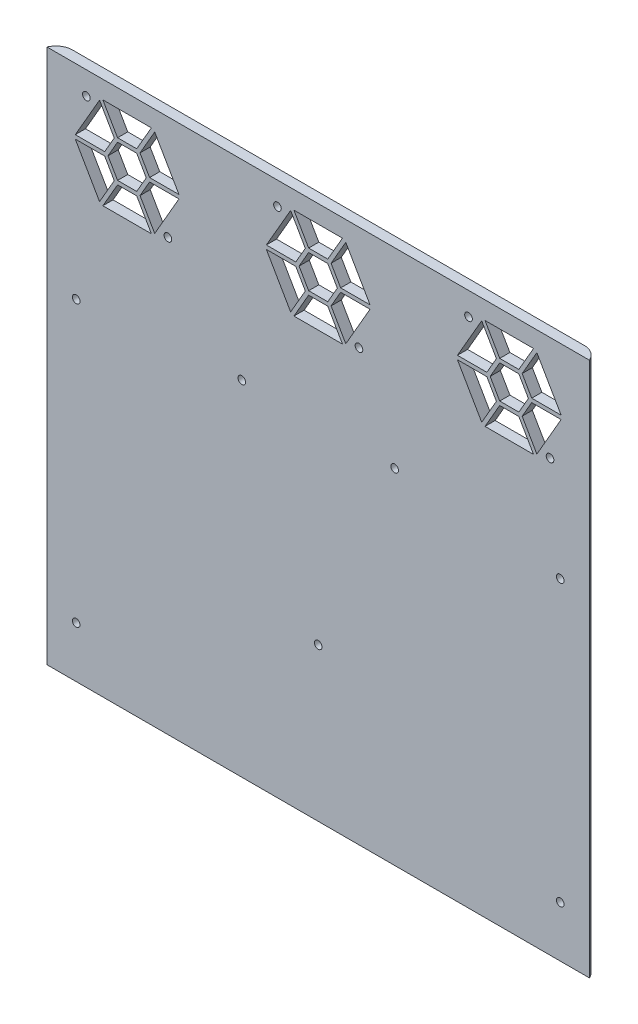
from build123d import *
from OCP.BRepFilletAPI import BRepFilletAPI_MakeChamfer

# Parameters (mm, degrees)
ESQUISSE1_W                = 213
ESQUISSE1_H                = 210
BOSS_EXTRU_1_DEPTH         = 4
CHANFREIN1_SIZE            = 4
CHANFREIN1_SIZE_2          = 2.309401077
CONG_1_R                   = 6.5
ESQUISSE2_R                = 1.5
ENL_V_MAT_EXTRU_1_DEPTH    = 236.495753677
ESQUISSE3_R                = 1.5
ENL_V_MAT_EXTRU_2_DEPTH    = 236.495753677
R_P_TITION_LIN_AIRE1_COUNT = 3
R_P_TITION_LIN_AIRE1_PITCH = 75
CHANFREIN2_SIZE            = 1.5


with BuildPart() as part:
    # Esquisse1 → Boss.-Extru.1 (new body)
    with BuildSketch(Plane.XY):
        with Locations((0, -105)):
            Rectangle(ESQUISSE1_W, ESQUISSE1_H)
    extrude(amount=BOSS_EXTRU_1_DEPTH)

    # Chanfrein1
    chanfrein1_edges_1 = [part.edges().sort_by_distance(p)[0] for p in [
        (-106.5, -105, 0),
    ]]
    chanfrein1_side_1 = [part.faces().sort_by_distance(p)[0] for p in [
        (-106.5, -105, 0.046188022),
    ]]
    chanfrein1_edges_2 = [part.edges().sort_by_distance(p)[0] for p in [
        (106.5, -105, 0),
    ]]
    chanfrein1_side_2 = [part.faces().sort_by_distance(p)[0] for p in [
        (106.5, -105, 0.046188022),
    ]]
    chanfrein1 = BRepFilletAPI_MakeChamfer(part.part.solid().wrapped)
    for e in chanfrein1_edges_1:
        chanfrein1.Add(CHANFREIN1_SIZE - 0.0001, CHANFREIN1_SIZE_2 - 0.0001, e.wrapped, chanfrein1_side_1[0].wrapped)
    for e in chanfrein1_edges_2:
        chanfrein1.Add(CHANFREIN1_SIZE - 0.0001, CHANFREIN1_SIZE_2 - 0.0001, e.wrapped, chanfrein1_side_2[0].wrapped)
    add(Compound.cast(chanfrein1.Shape()), mode=Mode.REPLACE)  # a hair under: the kernel refuses the full size

    # Congé1
    cong_1_edges = [part.edges().sort_by_distance(p)[0] for p in [
        (104.190698923, -105, 0),
        (-104.190698923, -105, 0),
    ]]
    fillet(cong_1_edges, radius=CONG_1_R)

    # Esquisse2 → Enlèv. mat.-Extru.1 (cut, through all)
    with BuildSketch(Plane(origin=(0, 0, 0), x_dir=(-1, 0, 0), z_dir=(0, 0, -1))):
        with Locations((-30, -75)):
            Circle(ESQUISSE2_R)
        with Locations((-95, -80)):
            Circle(ESQUISSE2_R)
        with Locations((-95, -190)):
            Circle(ESQUISSE2_R)
        with Locations(Location((95, -190, 0), (0, 0, 180))):
            Circle(ESQUISSE2_R)
        with Locations(Location((95, -80, 0), (0, 0, 180))):
            Circle(ESQUISSE2_R)
        with Locations(Location((30, -75, 0), (0, 0, 180))):
            Circle(ESQUISSE2_R)
        with Locations((0, -150)):
            Circle(ESQUISSE2_R)
    extrude(amount=-ENL_V_MAT_EXTRU_1_DEPTH, mode=Mode.SUBTRACT)

    # Esquisse3 → Enlèv. mat.-Extru.2 (cut, through all)
    with BuildSketch(Plane(origin=(0, 0, 0), x_dir=(-1, 0, 0), z_dir=(0, 0, -1))):
        with Locations(Location((-91, -41, 0), (0, 0, 180))):
            Circle(ESQUISSE3_R)
        with Locations(Location((-59, -9, 0), (0, 0, 180))):
            Circle(ESQUISSE3_R)
        Polygon((-67.494446501, -25), (-71.24722325, -18.5), (-78.75277675, -18.5), (-82.505553499, -25), (-78.75277675, -31.5), (-71.24722325, -31.5), align=None)
        Polygon((-84.526279442, -7), (-65.473720558, -7), (-71.24722325, -17), (-78.75277675, -17), align=None)
        Polygon((-64.174682453, -7.75), (-54.648403011, -24.25), (-66.195408395, -24.25), (-69.948185145, -17.75), align=None)
        Polygon((-54.648403011, -25.75), (-64.174682453, -42.25), (-69.948185145, -32.25), (-66.195408395, -25.75), align=None)
        Polygon((-65.473720558, -43), (-84.526279442, -43), (-78.75277675, -33), (-71.24722325, -33), align=None)
        Polygon((-85.825317547, -42.25), (-95.351596989, -25.75), (-83.804591605, -25.75), (-80.051814855, -32.25), align=None)
        Polygon((-95.351596989, -24.25), (-85.825317547, -7.75), (-80.051814855, -17.75), (-83.804591605, -24.25), align=None)
    enl_v_mat_extru_2 = extrude(amount=-ENL_V_MAT_EXTRU_2_DEPTH, mode=Mode.SUBTRACT)

    # Répétition linéaire1: Enlèv. mat.-Extru.2 ×3
    with Locations(*[(-i * R_P_TITION_LIN_AIRE1_PITCH, 0, 0) for i in range(1, R_P_TITION_LIN_AIRE1_COUNT)]):
        add(enl_v_mat_extru_2, mode=Mode.SUBTRACT)

    # Chanfrein2
    chanfrein2_edges = [part.edges().sort_by_distance(p)[0] for p in [
        (14.5, -41, 0),
        (-60.5, -41, 0),
        (-17.5, -9, 0),
        (-92.5, -9, 0),
        (96.5, -80, 0),
        (96.5, -190, 0),
        (-96.5, -190, 0),
        (-96.5, -80, 0),
        (1.5, -150, 0),
        (89.5, -41, 0),
        (57.5, -9, 0),
    ]]
    chamfer(chanfrein2_edges, length=CHANFREIN2_SIZE)


solid = part.part
